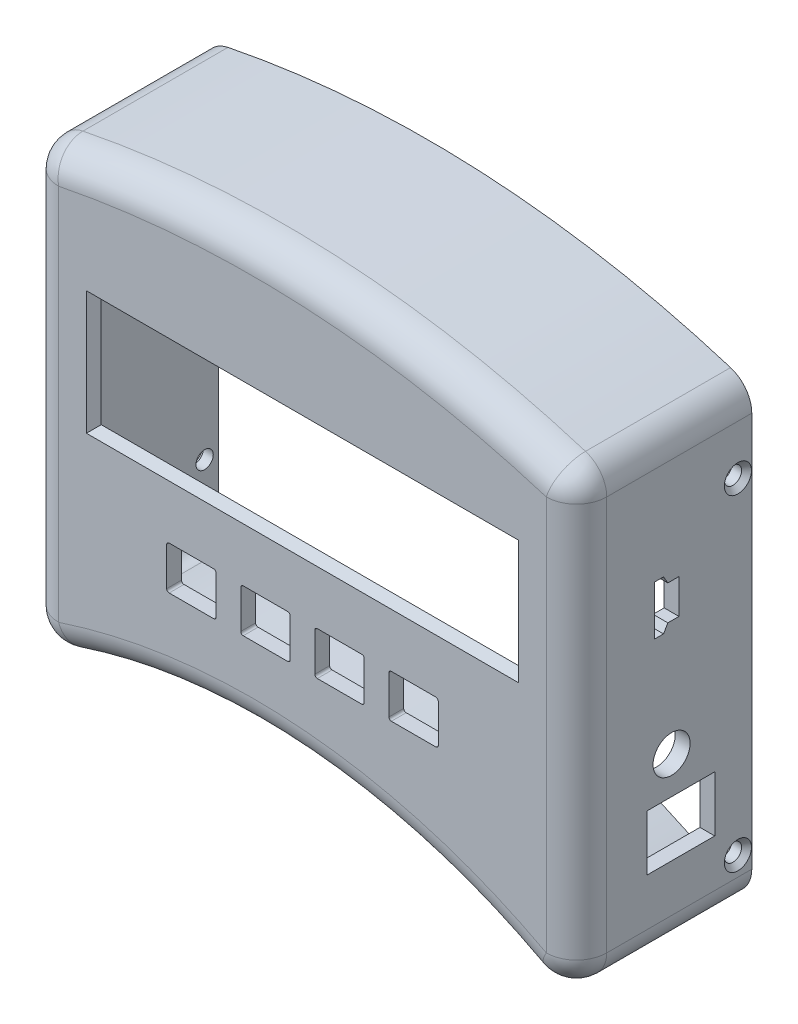
from build123d import *

# Parameters (mm, degrees)
EXTRUDE_11098_DEPTH         = 26
FILLET_11147_R              = 2.5
SHELL_11558_T               = 2.4
SKETCH_12788_W              = 77
SKETCH_12788_H              = 26
CUT_EXTRUDE_13245_DEPTH     = 1.2
CUT_EXTRUDE_START           = -2.4
CUT_EXTRUDE_14712_OUTLINE_W = 8
CUT_EXTRUDE_14712_OUTLINE_H = 7
CUT_EXTRUDE_14712_DEPTH     = 2.4
CUT_EXTRUDE_START_2         = -3
CUT_EXTRUDE_16699_OUTLINE_W = 11
CUT_EXTRUDE_16699_OUTLINE_H = 9
CUT_EXTRUDE_16699_OUTLINE_R = 3
CUT_EXTRUDE_16699_DEPTH     = 4
SKETCH_16755_R              = 1.4
CUT_EXTRUDE_17028_DEPTH     = 3
SKETCH_17076_R              = 1.4
CUT_EXTRUDE_17283_DEPTH     = 3
CHAMFER_17332_SIZE          = 0.8
FILLET_1_R                  = 0.4
SKETCH_19008_R              = 2.5
CUT_EXTRUDE_19107_DEPTH     = 100


with BuildPart() as part:
    # Extrude 11098: read off the stored shape, not the designer's step
    # Extrude 11098 outline → Extrude 11098 (new body)
    with BuildSketch(Plane.XY):
        with BuildLine():
            ThreePointArc((50, 154.142813358), (8.283821468, 161.837527205), (-34, 158.442440368))
            Line((-34, 158.442440368), (-34, 91.699111876))
            ThreePointArc((-34, 91.699111876), (8.866783155, 97.3966492), (50, 84.051931084))
            Line((50, 84.051931084), (50, 154.142813358))
        make_face()
    extrude(amount=EXTRUDE_11098_DEPTH)

    # Fillet 11147
    fillet_11147_edges = [part.edges().sort_by_distance(p)[0] for p in [
        (8.866783155, 97.3966492, 26),
        (50, 119.097372221, 26),
        (8.283821468, 161.837527205, 26),
        (50, 154.142813358, 13),
        (50, 84.051931084, 13),
        (-34, 91.699111876, 13),
        (-34, 158.442440368, 13),
        (-34, 125.070776122, 26),
    ]]
    fillet(fillet_11147_edges, radius=FILLET_11147_R)

    # Shell 11558
    shell_11558_openings = [part.faces().sort_by_distance(p)[0] for p in [
        (8.321154323, 127.154130668, 0),
    ]]
    offset(amount=SHELL_11558_T, openings=shell_11558_openings, kind=Kind.INTERSECTION)

    # Cut-Extrude 12697: read off the stored shape, not the designer's step
    # Cut-Extrude 12697: loft between two sections, ruled curve by curve
    cut_extrude_12697_from = [
        Edge.make_line((-24.6, 126.4, 26), (40.6, 126.4, 26)),
        Edge.make_line((-24.6, 141.6, 26), (-24.6, 126.4, 26)),
        Edge.make_line((40.6, 141.6, 26), (-24.6, 141.6, 26)),
        Edge.make_line((40.6, 126.4, 26), (40.6, 141.6, 26)),
    ]
    cut_extrude_12697_to = [
        Edge.make_line((-27, 124, 28.4), (43, 124, 28.4)),
        Edge.make_line((-27, 144, 28.4), (-27, 124, 28.4)),
        Edge.make_line((43, 144, 28.4), (-27, 144, 28.4)),
        Edge.make_line((43, 124, 28.4), (43, 144, 28.4)),
    ]
    cut_extrude_12697 = Solid(Shell([*[Face.make_surface_from_curves(cut_extrude_12697_from[k], cut_extrude_12697_to[k]) for k in range(4)], Face(Wire(cut_extrude_12697_from)), Face(Wire(cut_extrude_12697_to))]))
    add(cut_extrude_12697, mode=Mode.SUBTRACT)

    # Sketch 12788 → Cut-Extrude 13245 (cut)
    with BuildSketch(Plane(origin=(0, 0, 26), x_dir=(-1, 0, 0), z_dir=(0, 0, -1))):
        with Locations((-8, 134)):
            Rectangle(SKETCH_12788_W, SKETCH_12788_H)
    extrude(amount=-CUT_EXTRUDE_13245_DEPTH, mode=Mode.SUBTRACT)

    # Cut-Extrude 14712: read off the stored shape, not the designer's step
    # Cut-Extrude 14712 outline → Cut-Extrude 14712 (cut)
    with BuildSketch(Plane.XY.offset(28.4).offset(CUT_EXTRUDE_START)):
        with Locations((26.004631823, 111.792348678)):
            Rectangle(CUT_EXTRUDE_14712_OUTLINE_W, CUT_EXTRUDE_14712_OUTLINE_H)
        with Locations((14.004631823, 111.792348678)):
            Rectangle(CUT_EXTRUDE_14712_OUTLINE_W, CUT_EXTRUDE_14712_OUTLINE_H)
        with Locations((2.004631823, 111.792348678)):
            Rectangle(CUT_EXTRUDE_14712_OUTLINE_W, CUT_EXTRUDE_14712_OUTLINE_H)
        with Locations((-9.995368177, 111.792348678)):
            Rectangle(CUT_EXTRUDE_14712_OUTLINE_W, CUT_EXTRUDE_14712_OUTLINE_H)
    extrude(amount=CUT_EXTRUDE_14712_DEPTH, mode=Mode.SUBTRACT)

    # Cut-Extrude 16699: read off the stored shape, not the designer's step
    # Cut-Extrude 16699 outline → Cut-Extrude 16699 (cut)
    with BuildSketch(Plane(origin=(52.4, 0, 0), x_dir=(0, 0, -1), z_dir=(1, 0, 0)).offset(CUT_EXTRUDE_START_2)):
        with Locations((-11.5, 100.5)):
            Rectangle(CUT_EXTRUDE_16699_OUTLINE_W, CUT_EXTRUDE_16699_OUTLINE_H)
        with Locations((-13, 111)):
            Circle(CUT_EXTRUDE_16699_OUTLINE_R)
        Polygon((-14.3, 128.5), (-13.6, 129.7), (-11.8, 129.7), (-11.8, 135.3), (-13.6, 135.3), (-14.3, 136.5), (-15.8, 136.5), (-15.8, 128.5), align=None)
    extrude(amount=CUT_EXTRUDE_16699_DEPTH, mode=Mode.SUBTRACT)

    # Sketch 16755 → Cut-Extrude 17028 (cut)
    with BuildSketch(Plane(origin=(52.4, 0, 0), x_dir=(0, 0, -1), z_dir=(1, 0, 0))):
        with Locations(Location((-2.25, 91.438690467, 0), (0, 0, 90))):
            Circle(SKETCH_16755_R)
        with Locations(Location((-2.25, 144.314674038, 0), (0, 0, 90))):
            Circle(SKETCH_16755_R)
    extrude(amount=-CUT_EXTRUDE_17028_DEPTH, mode=Mode.SUBTRACT)

    # Sketch 17076 → Cut-Extrude 17283 (cut)
    with BuildSketch(Plane.ZY.offset(36.4).offset(CUT_EXTRUDE_START_2)):
        with Locations(Location((2.25, 103.724598888, 0), (0, 0, 270))):
            Circle(SKETCH_17076_R)
        with Locations(Location((2.25, 144.314674038, 0), (0, 0, 90))):
            Circle(SKETCH_17076_R)
    extrude(amount=CUT_EXTRUDE_17283_DEPTH, mode=Mode.SUBTRACT)

    # Chamfer 17332
    chamfer_17332_edges = [part.edges().sort_by_distance(p)[0] for p in [
        (52.4, 90.038690467, 2.25),
        (52.4, 142.914674038, 2.25),
        (-36.4, 142.914674038, 2.25),
        (-36.4, 105.124598888, 2.25),
    ]]
    chamfer(chamfer_17332_edges, length=CHAMFER_17332_SIZE)

    # Скругление1
    fillet_1_edges = [part.edges().sort_by_distance(p)[0] for p in [
        (-5.995368177, 115.292348678, 27.2),
        (-5.995368177, 108.292348678, 27.2),
        (-13.995368177, 108.292348678, 27.2),
        (-13.995368177, 115.292348678, 27.2),
        (-1.995368177, 108.292348678, 27.2),
        (-1.995368177, 115.292348678, 27.2),
        (6.004631823, 115.292348678, 27.2),
        (6.004631823, 108.292348678, 27.2),
        (10.004631823, 108.292348678, 27.2),
        (10.004631823, 115.292348678, 27.2),
        (18.004631823, 115.292348678, 27.2),
        (18.004631823, 108.292348678, 27.2),
        (22.004631823, 108.292348678, 27.2),
        (22.004631823, 115.292348678, 27.2),
        (30.004631823, 115.292348678, 27.2),
        (30.004631823, 108.292348678, 27.2),
    ]]
    fillet(fillet_1_edges, radius=FILLET_1_R)

    # Sketch 19008 → Cut-Extrude 19107 (cut)
    with BuildSketch(Plane(origin=(0, 0, 0), x_dir=(1, 0, 0), z_dir=(0, 1, 0))):
        with Locations(Location((31.62731448, -8.5, 0), (0, 0, 90))):
            Circle(SKETCH_19008_R)
    extrude(amount=CUT_EXTRUDE_19107_DEPTH, mode=Mode.SUBTRACT)


solid = part.part
